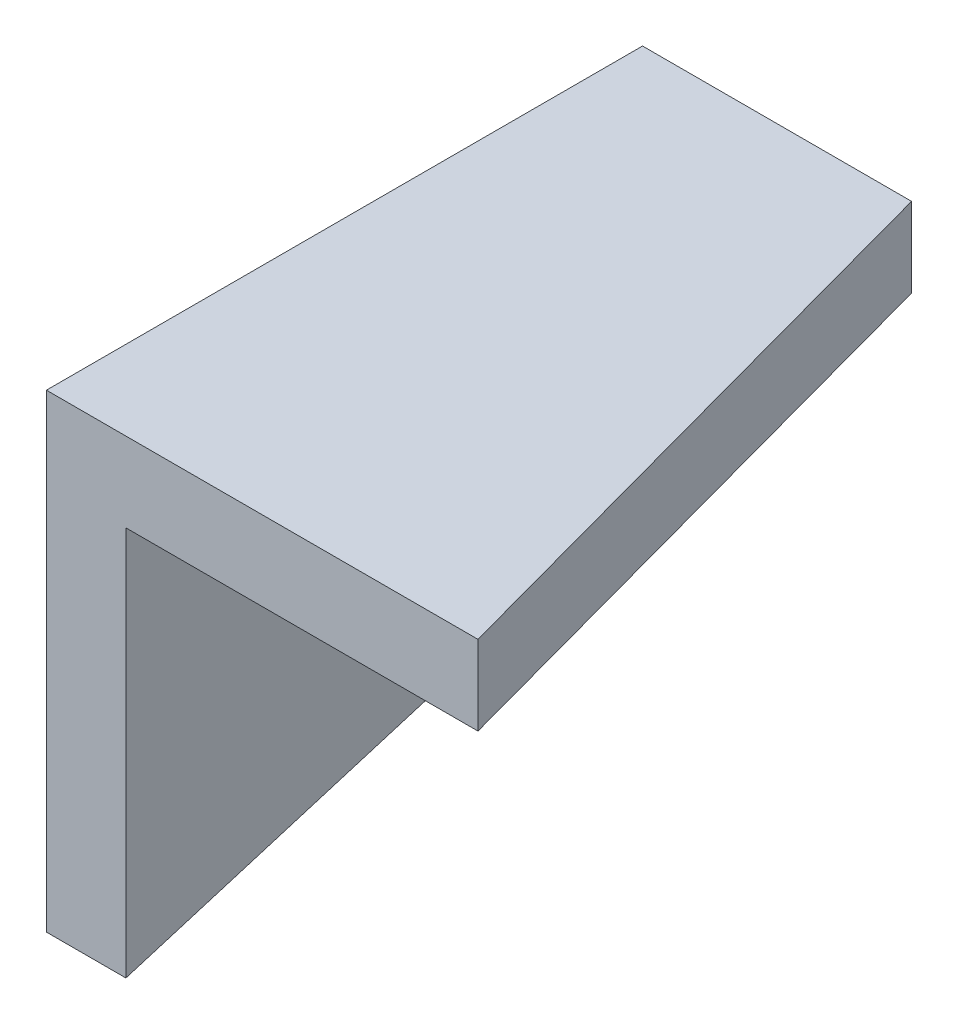
from build123d import *

# Parameters (mm, degrees)
BOSS_EXTRUDE1_DEPTH = 30
CUT_EXTRUDE1_DEPTH  = 10
CUT_EXTRUDE2_DEPTH  = 10


with BuildPart() as part:
    # Sketch1 → Boss-Extrude1 (new, symmetric)
    with BuildSketch(Plane.XY):
        Polygon((40, 0), (0, 0), (0, -40), (-8, -40), (-8, 8), (40, 8), align=None)
    extrude(amount=BOSS_EXTRUDE1_DEPTH, both=True)

    # Sketch2 → Cut-Extrude1 (cut)
    with BuildSketch(Plane.XZ):
        Polygon((35.435421948, 30), (19.080611818, -30), (40, -30), (40, 30), align=None)
    extrude(amount=-CUT_EXTRUDE1_DEPTH, mode=Mode.SUBTRACT)

    # Sketch3 → Cut-Extrude2 (cut)
    with BuildSketch(Plane(origin=(0, 0, 0), x_dir=(0, 0, -1), z_dir=(1, 0, 0))):
        Polygon((30, -21.13), (-30, -39.24), (-30, -40), (30, -40), align=None)
    extrude(amount=-CUT_EXTRUDE2_DEPTH, mode=Mode.SUBTRACT)


solid = part.part
